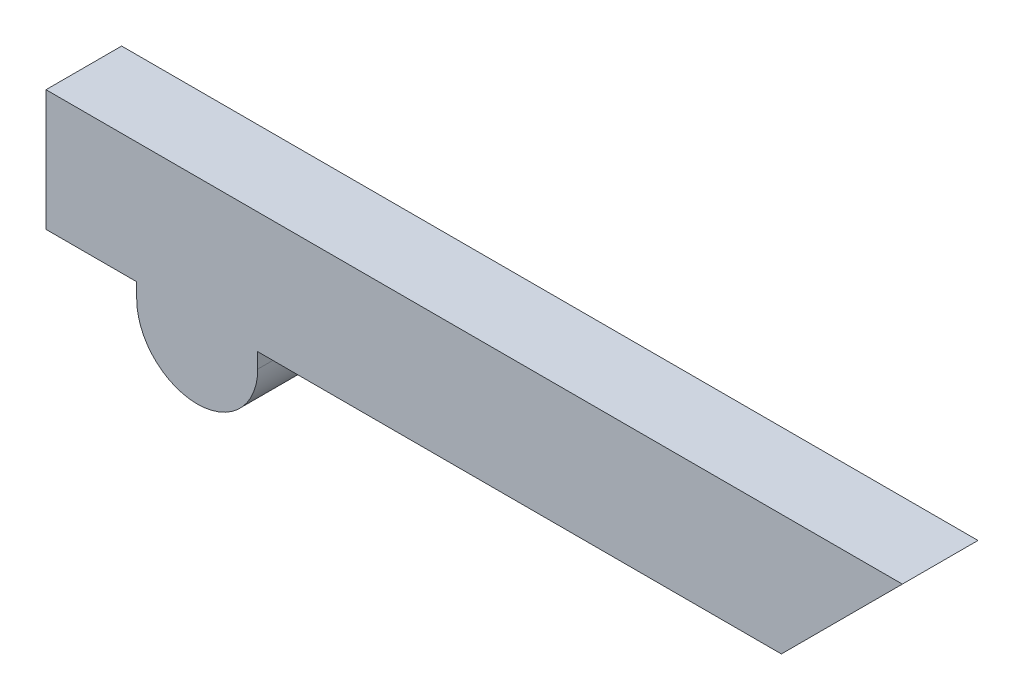
from build123d import *

# Parameters (mm, degrees)
SHAPE_DEPTH = 1


with BuildPart() as part:
    # Sketch1 → Shape (new body)
    with BuildSketch(Plane.XY):
        with BuildLine():
            Line((12.85, 11.475), (12.85, 11.275))
            ThreePointArc((12.85, 11.275), (13.65, 10.475), (14.45, 11.275))
            Line((14.45, 11.275), (14.45, 11.475))
            Line((14.45, 11.475), (21.374494937, 11.475))
            Line((21.374494937, 11.475), (22.974494937, 13.075))
            Line((22.974494937, 13.075), (11.65, 13.075))
            Line((11.65, 13.075), (11.65, 11.475))
            Line((11.65, 11.475), (12.85, 11.475))
        make_face()
    extrude(amount=SHAPE_DEPTH)


solid = part.part
